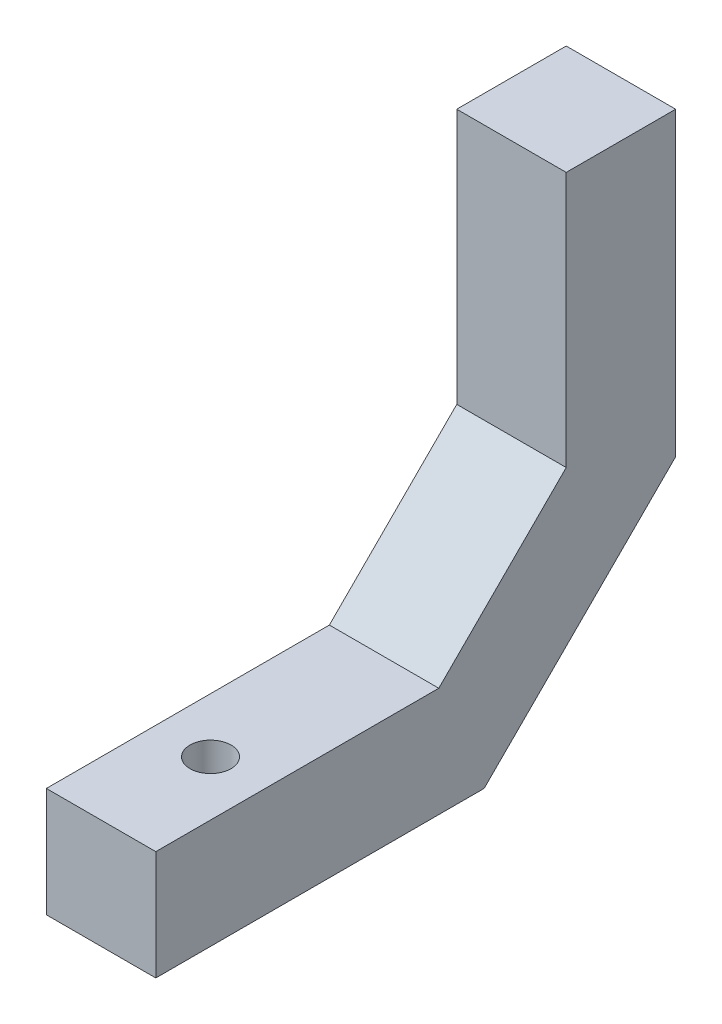
from build123d import *

# Parameters (mm, degrees)
BOSS_EXTRUDE1_DEPTH      = 4
BOSS_EXTRUDE1_DEPTH_BACK = 4
SKETCH3_R                = 1.5
CUT_EXTRUDE1_DEPTH       = 48.370877129


with BuildPart() as part:
    # Sketch1 → Boss-Extrude1 (new, two sides: drawn at the far end of the back side and taken through both)
    with BuildSketch(Plane(origin=(0, 0, 0), x_dir=(0, 0, -1), z_dir=(1, 0, 0)).offset(-BOSS_EXTRUDE1_DEPTH_BACK)):
        Polygon((-8, 4), (0, 4), (0, -18), (-14, -32), (-30, -32), (-38, -32), (-38, -24), (-30, -24), (-17.313708499, -24), (-8, -14.686291501), align=None)
    extrude(amount=BOSS_EXTRUDE1_DEPTH + BOSS_EXTRUDE1_DEPTH_BACK)

    # Sketch3 → Cut-Extrude1 (cut, through all)
    with BuildSketch(Plane(origin=(0, -24, 0), x_dir=(1, 0, 0), z_dir=(0, 1, 0))):
        with Locations((0, -30)):
            Circle(SKETCH3_R)
    extrude(amount=-CUT_EXTRUDE1_DEPTH, mode=Mode.SUBTRACT)


solid = part.part
